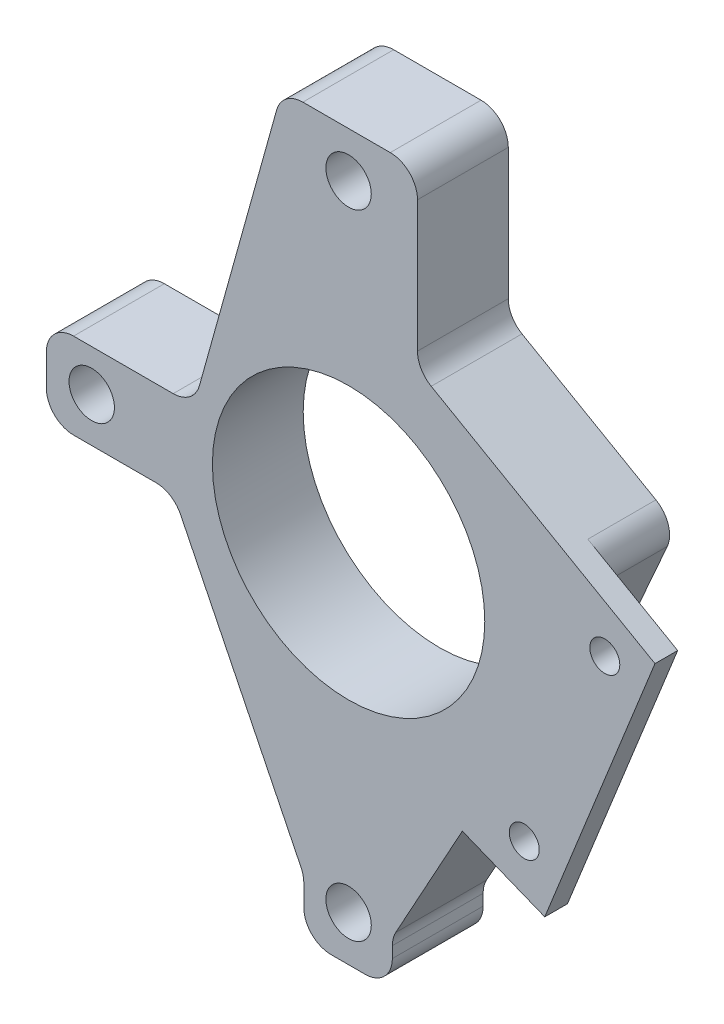
from build123d import *

# Parameters (mm, degrees)
SKETCH1_R           = 38.1
SKETCH1_R_2         = 6.35
BOSS_EXTRUDE1_DEPTH = 25.4
CUT_EXTRUDE1_DEPTH  = 19.05
SKETCH3_R           = 4.191
CUT_EXTRUDE2_DEPTH  = 136.814026098
FILLET1_R           = 7.62


with BuildPart() as part:
    # Sketch1 → Boss-Extrude1 (new body)
    with BuildSketch(Plane.XY):
        Polygon((-18.576252895, 100.365223368), (19.281255226, 100.365223368), (19.281255226, 51.662487547), (85.717168685, 13.57632424), (54.880053148, -63.203130515), (31.826573213, -53.944106385), (12.245486317, -89.539213014), (12.245486317, -102.239213014), (-12.530801949, -102.239213014), (-12.530801949, -86.863546075), (-49.113541671, -12.382140744), (-84.5631354, -12.382140744), (-84.5631354, 11.598068918), (-43.284636092, 11.598068918), align=None)
        Circle(SKETCH1_R, mode=Mode.SUBTRACT)
        with Locations((0, 87.665223368)):
            Circle(SKETCH1_R_2, mode=Mode.SUBTRACT)
        with Locations((0, -89.539213014)):
            Circle(SKETCH1_R_2, mode=Mode.SUBTRACT)
        with Locations((-71.8631354, 0)):
            Circle(SKETCH1_R_2, mode=Mode.SUBTRACT)
    extrude(amount=BOSS_EXTRUDE1_DEPTH)

    # Sketch2 → Cut-Extrude1 (cut)
    with BuildSketch(Plane.XY):
        Polygon((54.880053148, -63.203130515), (85.717168685, 13.57632424), (66.538177491, 24.571193621), (31.826573213, -53.944106385), align=None)
    extrude(amount=CUT_EXTRUDE1_DEPTH, mode=Mode.SUBTRACT)

    # Sketch3 → Cut-Extrude2 (cut, through all)
    with BuildSketch(Plane.XY.offset(25.4)):
        with Locations((71.679164996, 8.361848351)):
            Circle(SKETCH3_R)
        with Locations((49.148937242, -47.734792738)):
            Circle(SKETCH3_R)
    extrude(amount=-CUT_EXTRUDE2_DEPTH, mode=Mode.SUBTRACT)

    # Fillet1
    fillet1_edges = [part.edges().sort_by_distance(p)[0] for p in [
        (-18.576252895, 100.365223368, 12.7),
        (19.281255226, 100.365223368, 12.7),
        (19.281255226, 51.662487547, 12.7),
        (66.538177491, 24.571193621, 9.525),
        (12.245486317, -89.539213014, 12.7),
        (12.245486317, -102.239213014, 12.7),
        (-12.530801949, -102.239213014, 12.7),
        (-12.530801949, -86.863546075, 12.7),
        (-49.113541671, -12.382140744, 12.7),
        (-84.5631354, -12.382140744, 12.7),
        (-84.5631354, 11.598068918, 12.7),
        (-43.284636092, 11.598068918, 12.7),
    ]]
    fillet(fillet1_edges, radius=FILLET1_R)


solid = part.part
